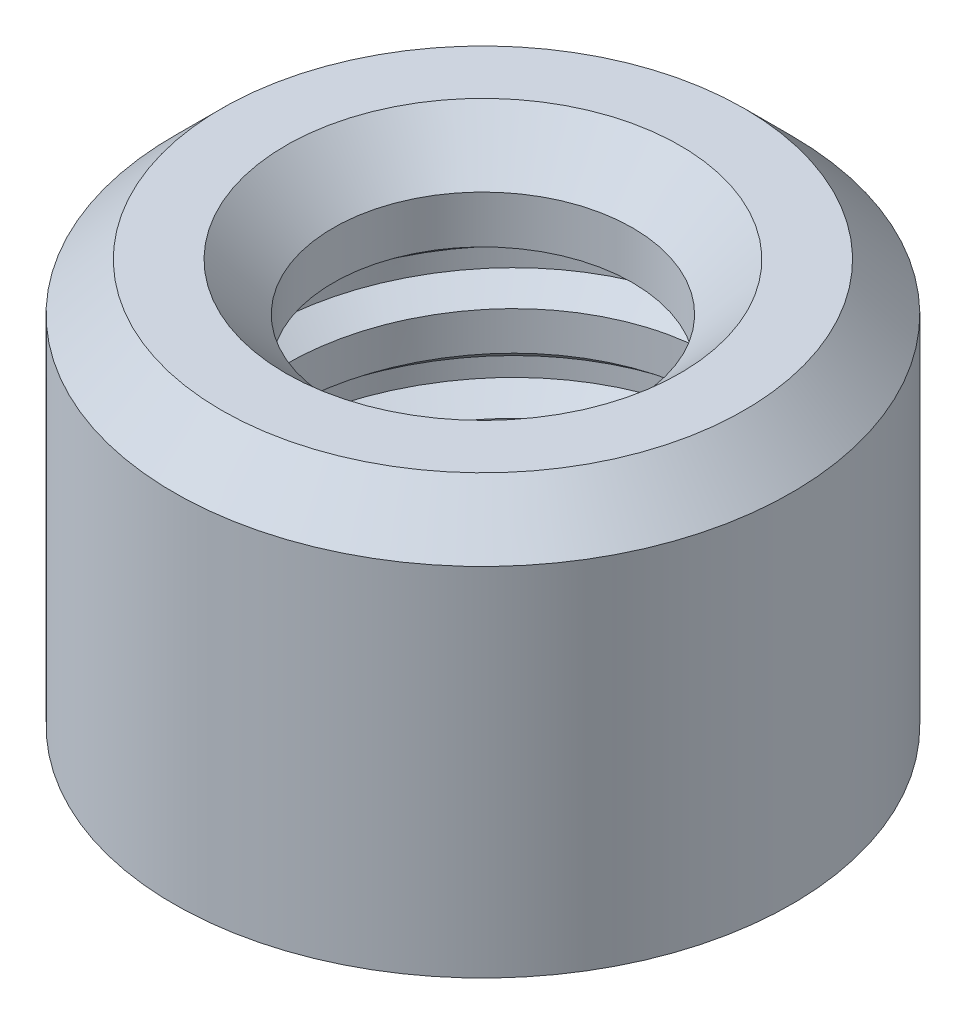
from build123d import *

# Parameters (mm, degrees)
SKETCH1_R           = 6.5
SKETCH1_R_2         = 4.5
BOSS_EXTRUDE1_DEPTH = 6.5
SKETCH2_R           = 6.5
SKETCH2_R_2         = 3.15
BOSS_EXTRUDE2_DEPTH = 2
CHAMFER1_SIZE       = 1
CUT_SWEEP1_PITCH    = 2
CUT_SWEEP1_FROM     = 0
CHAMFER2_SIZE       = 1


with BuildPart() as part:
    # Sketch1 → Boss-Extrude1 (new body)
    with BuildSketch(Plane(origin=(0, 0, 0), x_dir=(1, 0, 0), z_dir=(0, 1, 0))):
        with Locations(Location((0, 0, 0), (0, 0, 90))):
            Circle(SKETCH1_R)
        with Locations(Location((0, 0, 0), (0, 0, 90))):
            Circle(SKETCH1_R_2, mode=Mode.SUBTRACT)
    extrude(amount=BOSS_EXTRUDE1_DEPTH)

    # Sketch2 → Boss-Extrude2 (add)
    with BuildSketch(Plane(origin=(0, 6.5, 0), x_dir=(1, 0, 0), z_dir=(0, 1, 0))):
        with Locations(Location((0, 0, 0), (0, 0, 90))):
            Circle(SKETCH2_R)
        with Locations(Location((0, 0, 0), (0, 0, 270))):
            Circle(SKETCH2_R_2, mode=Mode.SUBTRACT)
    extrude(amount=BOSS_EXTRUDE2_DEPTH)

    # Chamfer1
    chamfer1_edges = [part.edges().sort_by_distance(p)[0] for p in [
        (0, 8.5, -3.15),
    ]]
    chamfer(chamfer1_edges, length=CHAMFER1_SIZE)

    # Cut-Sweep1: arcs per turn and ends read off the stored shape
    # Cut-Sweep1: the profile of Sketch4 screwed along a left-hand helix through 5 turns, 10 arcs to a turn; built about Z, then put on its axis
    cut_sweep1_z = Axis((0, 0, 0), (0, 0, 1))
    cut_sweep1_corners = [(3.98389389, -0.070447866, -2.995933246), (3.996623975, 0.070667732, -1.000958476), (4.991511684, 0.01377238, -1.805297563), (4.988965667, -0.01445074, -2.204292517)]
    with BuildLine(mode=Mode.PRIVATE) as cut_sweep1_profile:
        Line(cut_sweep1_corners[0], cut_sweep1_corners[1])
        Line(cut_sweep1_corners[1], cut_sweep1_corners[2])
        Line(cut_sweep1_corners[2], cut_sweep1_corners[3])
        Line(cut_sweep1_corners[3], cut_sweep1_corners[0])
    cut_sweep1_cap = Face(cut_sweep1_profile.wire())
    cut_sweep1_turn_angles = [0, -18, -36, -54, -72, -90, -108, -126, -144, -162, -180, -198, -216, -234, -252, -270, -288, -306, -324, -342, -360]
    cut_sweep1_turn_weights = [1, 0.9510565162951535, 1, 0.9510565162951535, 1, 0.9510565162951535, 1, 0.9510565162951535, 1, 0.9510565162951535, 1, 0.9510565162951535, 1, 0.9510565162951535, 1, 0.9510565162951535, 1, 0.9510565162951535, 1, 0.9510565162951535, 1]
    cut_sweep1_turn_rails = [Edge.make_bspline([Vector(p[0], p[1], 0).rotate(cut_sweep1_z, cut_sweep1_turn_angles[k]) / cut_sweep1_turn_weights[k] + Vector(0, 0, p[2] + -CUT_SWEEP1_PITCH * cut_sweep1_turn_angles[k] / 360) for k in range(21)], [0, 0, 0, 1, 1, 2, 2, 3, 3, 4, 4, 5, 5, 6, 6, 7, 7, 8, 8, 9, 9, 10, 10, 10], 2, cut_sweep1_turn_weights) for p in cut_sweep1_corners]
    cut_sweep1_turn_sides = [Face.make_surface_from_curves(cut_sweep1_turn_rails[p[0]], cut_sweep1_turn_rails[p[1]]) for p in [(0, 1), (1, 2), (2, 3), (3, 0)]]
    cut_sweep1 = Plane(origin=(0, 6.5, 0), x_dir=(-0.7071067811865537, 0, 0.7071067811865414), z_dir=(0, -1, 0)) * split(Solid(Shell([*[p.moved(Location((0, 0, CUT_SWEEP1_PITCH * i))) for i in range(5) for p in cut_sweep1_turn_sides], cut_sweep1_cap, cut_sweep1_cap.rotate(cut_sweep1_z, -1800).moved(Location((0, 0, -CUT_SWEEP1_PITCH * -1800 / 360)))])), bisect_by=Plane.XY.offset(CUT_SWEEP1_FROM), keep=Keep.TOP, mode=Mode.PRIVATE)
    add(cut_sweep1, mode=Mode.SUBTRACT)

    # Chamfer2
    chamfer2_edges = [part.edges().sort_by_distance(p)[0] for p in [
        (0, 8.5, 6.5),
    ]]
    chamfer(chamfer2_edges, length=CHAMFER2_SIZE)


solid = part.part
